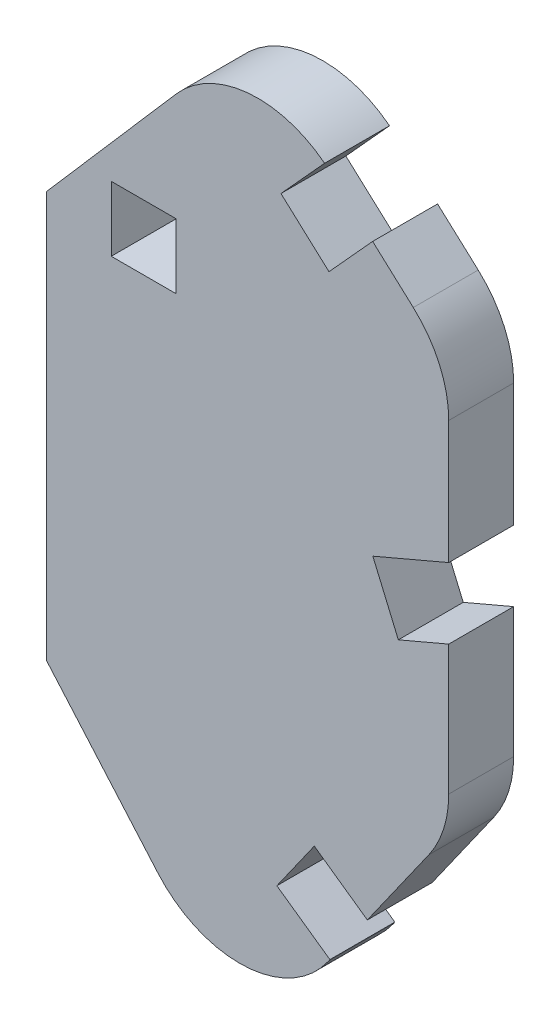
from build123d import *

# Parameters (mm, degrees)
SKETCH1_W           = 1.524
SKETCH1_H           = 1.524
BOSS_EXTRUDE1_DEPTH = 1.524
FILLET1_R           = 2.54


with BuildPart() as part:
    # Sketch1 → Boss-Extrude1 (new body)
    with BuildSketch(Plane.XY):
        Polygon((1.524, -10.497308023), (1.524, -0.972308023), (6.269557814, 4.493617922), (8.055541686, 2.871017969), (7.030741716, 1.743028155), (8.158731531, 0.718228185), (9.183531501, 1.846217999), (10.969515373, 0.223618046), (10.969515373, -3.789821466), (9.188202018, -4.549828763), (9.786265437, -5.951576297), (10.969515373, -5.446736099), (10.969515373, -9.301381954), (9.058811588, -12.009667231), (7.813530127, -11.131117242), (6.934980138, -12.376398702), (8.180261599, -13.254948692), (6.269557814, -15.963233969), align=None)
        with Locations((3.81, -0.762)):
            Rectangle(SKETCH1_W, SKETCH1_H, mode=Mode.SUBTRACT)
    extrude(amount=BOSS_EXTRUDE1_DEPTH)

    # Fillet1
    # the kernel refuses this fillet: 2.54 mm, written as the material it takes off along each edge
    with BuildSketch(Plane(origin=(6.269557814, 4.493617922, -6.477892314), x_dir=(-0.6555947155448552, -0.7551129511203344, 0), z_dir=(0, 0, 1))) as fillet1_piece_1:
        with BuildLine():
            CenterArc((2.591156926, 2.54), FILLET1_R, 182.87981761, 87.12018239)
            Line((0.05436465, 2.412387507), (0.003628804, 2.409835257))
            ThreePointArc((0.003628804, 2.409835257), (-0.023604781, 1.207338273), (-0.050787105, 0.001144519))
            Line((-0.050787105, 0.001144519), (0, -0.0508))
            Line((0, -0.0508), (2.591156926, -0.0508))
            Line((2.591156926, -0.0508), (2.591156926, 0))
        make_face()
    extrude(amount=14.479784629, mode=Mode.SUBTRACT)
    with BuildSketch(Plane(origin=(10.969515373, 0.223618046, -2.81023831), x_dir=(-0.7401507968211615, 0.6724409252603532, 0), z_dir=(0, 0, 1))) as fillet1_piece_2:
        with BuildLine():
            CenterArc((FILLET1_R * 0.442557214214, FILLET1_R), FILLET1_R, 222.255737271, 47.744262729)
            Line((-FILLET1_R * 0.297593582607, FILLET1_R * 0.32755907474), (-FILLET1_R * 0.312396598543, FILLET1_R * 0.314110256234))
            Line((-FILLET1_R * 0.312396598543, FILLET1_R * 0.314110256234), (-FILLET1_R * 0.00885114428429, -FILLET1_R * 0.02))
            Line((-FILLET1_R * 0.00885114428429, -FILLET1_R * 0.02), (FILLET1_R * 0.442557214214, -FILLET1_R * 0.02))
            Line((FILLET1_R * 0.442557214214, -FILLET1_R * 0.02), (FILLET1_R * 0.442557214214, 0))
        make_face()
    extrude(amount=7.144476621, mode=Mode.SUBTRACT)
    with BuildSketch(Plane(origin=(10.969515373, -9.301381954, -2.014527057), x_dir=(0, 1, 0), z_dir=(0, 0, 1))) as fillet1_piece_3:
        with BuildLine():
            CenterArc((FILLET1_R * 0.317248355422, FILLET1_R), FILLET1_R, 234.796910959, 35.203089041)
            Line((-FILLET1_R * 0.259228015403, FILLET1_R * 0.182886180584), (-FILLET1_R * 0.270757542819, FILLET1_R * 0.166543904196))
            Line((-FILLET1_R * 0.270757542819, FILLET1_R * 0.166543904196), (-FILLET1_R * 0.00634496710845, -FILLET1_R * 0.02))
            Line((-FILLET1_R * 0.00634496710845, -FILLET1_R * 0.02), (FILLET1_R * 0.317248355422, -FILLET1_R * 0.02))
            Line((FILLET1_R * 0.317248355422, -FILLET1_R * 0.02), (FILLET1_R * 0.317248355422, 0))
        make_face()
    extrude(amount=5.553054114, mode=Mode.SUBTRACT)
    with BuildSketch(Plane(origin=(6.269557814, -15.963233969, -8.10313634), x_dir=(0.5764763708249786, 0.8171138194159133, 0), z_dir=(0, 0, 1))) as fillet1_piece_4:
        with BuildLine():
            CenterArc((FILLET1_R * 1.27608446293, FILLET1_R), FILLET1_R, 166.167848872, 103.832151128)
            Line((FILLET1_R * 0.305084187293, FILLET1_R * 1.23907836523), (FILLET1_R * 0.28566418178, FILLET1_R * 1.24385993254))
            Line((FILLET1_R * 0.28566418178, FILLET1_R * 1.24385993254), (-FILLET1_R * 0.0255216892585, -FILLET1_R * 0.02))
            Line((-FILLET1_R * 0.0255216892585, -FILLET1_R * 0.02), (FILLET1_R * 1.27608446293, -FILLET1_R * 0.02))
            Line((FILLET1_R * 1.27608446293, -FILLET1_R * 0.02), (FILLET1_R * 1.27608446293, 0))
        make_face()
    extrude(amount=17.730272679, mode=Mode.SUBTRACT)


solid = part.part
